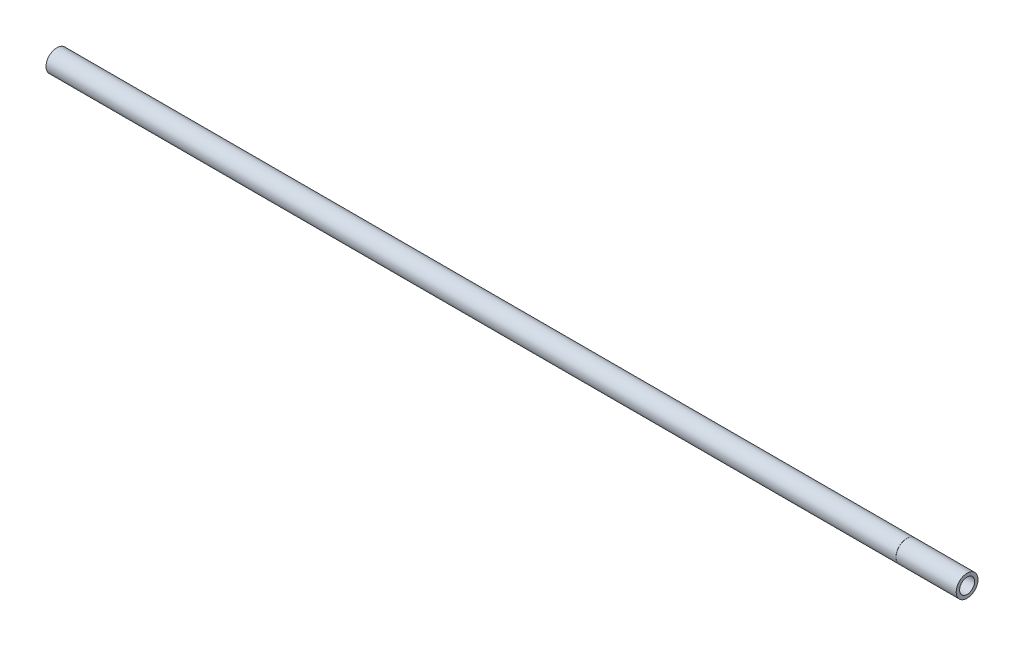
from build123d import *

# Parameters (mm, degrees)
ESBO_O1_R                = 0.96528919
RESSALTO_EXTRUS_O1_DEPTH = 110


# Read off the part's stored shape, not the designer's step: Base-Revolve
with BuildPart() as part:
    # Base-Revolve outline → Base-Revolve (revolve)
    with BuildSketch(Plane.YX):
        Polygon((1.45, 121), (1, 121), (1, 106), (0.999, 106), (1, 105.996267949), (1, 0), (1.45, 0), (1.45, 112.985008226), (1.442960002, 113), (1.45, 113), align=None)
    revolve(axis=Axis((0, 0, 0), (1, 0, 0)))


with BuildPart() as body_2:
    # Esboço1 → Ressalto-extrusão1 (new body)
    with BuildSketch(Plane.ZY):
        Circle(ESBO_O1_R)
    extrude(amount=-RESSALTO_EXTRUS_O1_DEPTH)


solid = Compound([part.part, body_2.part])
